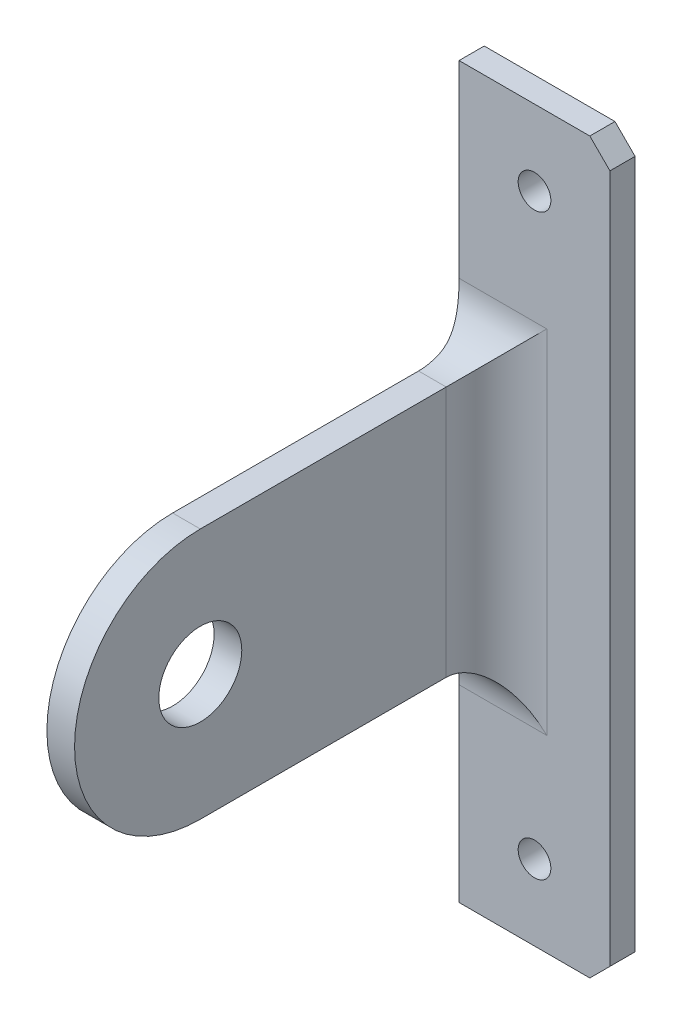
from build123d import *

# Parameters (mm, degrees)
SKETCH1_R               = 4.125
BOSS_EXTRUDE1_DEPTH     = 2.75
BOSS_EXTRUDE4_DEPTH     = 2.5
CUT_EXTRUDE2_REACH      = 80.314
SKETCH7_W               = 7
SKETCH7_H               = 16.5
SKETCH7_W_2             = 16
SKETCH7_H_2             = 8
CUT_EXTRUDE3_REACH      = 82.041
SKETCH9_W               = 2.75
SKETCH9_H               = 22.388822383
SKETCH8_W               = 2.75
SKETCH8_H               = 27.825
BOSS_EXTRUDE5_DEPTH     = 12.5
FILLET2_R               = 1
FILLET3_R               = 4
CUT_EXTRUDE4_DEPTH      = 74.103052287
CUT_EXTRUDE4_DEPTH_BACK = 74.103052287
SKETCH10_W              = 78.235731334
SKETCH10_H              = 6.290045588
SKETCH11_W              = 15
SKETCH11_H              = 2.5
BOSS_EXTRUDE6_DEPTH     = 12.5
BOSS_EXTRUDE7_DEPTH     = 2.5
SKETCH14_R              = 1.625
CUT_EXTRUDE5_DEPTH      = 2.5
FILLET4_R               = 5
CHAMFER1_SIZE           = 2


with BuildPart() as part:
    # Sketch1 → Boss-Extrude1 (new body)
    with BuildSketch(Plane(origin=(0, 0, 0), x_dir=(0, 0, -1), z_dir=(1, 0, 0))):
        with BuildLine():
            Line((0, 12.5), (34.45, 12.5))
            Line((34.45, 12.5), (34.45, -12.5))
            Line((34.45, -12.5), (0, -12.5))
            ThreePointArc((0, -12.5), (-12.5, 0), (0, 12.5))
        make_face()
        Circle(SKETCH1_R, mode=Mode.SUBTRACT)
    extrude(amount=BOSS_EXTRUDE1_DEPTH)

    # Sketch6 → Boss-Extrude4 (add)
    with BuildSketch(Plane(origin=(0, 0, -34.45), x_dir=(-1, 0, 0), z_dir=(0, 0, -1))):
        Polygon((-8.812505246, 36.25), (53.321583376, 36.25), (53.321583376, -36.25), (6.25, -36.25), (-19.178416624, -36.25), (-19.178416624, 36.25), align=None)
    extrude(amount=-BOSS_EXTRUDE4_DEPTH)

    # Sketch7 → Cut-Extrude2 (cut, up to next)
    with BuildSketch(Plane.XY.offset(-31.95), mode=Mode.PRIVATE) as cut_extrude2_sk1:
        with Locations((-1.711858899, -11.632438111)):
            Rectangle(SKETCH7_W, SKETCH7_H)
    cut_extrude2_tool1 = extrude(cut_extrude2_sk1.sketch, amount=-CUT_EXTRUDE2_REACH, mode=Mode.PRIVATE) & part.part
    # Sketch7 → Cut-Extrude2 (cut, up to next)
    with BuildSketch(Plane.XY.offset(-31.95), mode=Mode.PRIVATE) as cut_extrude2_sk2:
        with Locations((-16.5, 0)):
            Rectangle(SKETCH7_W_2, SKETCH7_H_2)
    cut_extrude2_tool2 = extrude(cut_extrude2_sk2.sketch, amount=-CUT_EXTRUDE2_REACH, mode=Mode.PRIVATE) & part.part
    add(cut_extrude2_tool1.solids().sort_by_distance((-1.711859, -11.632438, -31.95))[0], mode=Mode.SUBTRACT)
    add(cut_extrude2_tool2.solids().sort_by_distance((-16.5, 0, -31.95))[0], mode=Mode.SUBTRACT)

    # Sketch9 → Cut-Extrude3 (cut, up to next)
    with BuildSketch(Plane.XZ.offset(12.5), mode=Mode.PRIVATE) as cut_extrude3_sk1:
        with Locations((1.375, -20.755588809)):
            Rectangle(SKETCH9_W, SKETCH9_H)
    cut_extrude3_tool1 = extrude(cut_extrude3_sk1.sketch, amount=-CUT_EXTRUDE3_REACH, mode=Mode.PRIVATE) & part.part
    add(cut_extrude3_tool1.solids().sort_by_distance((1.375, -12.5, -20.755589))[0], mode=Mode.SUBTRACT)


with BuildPart() as cut_extrude3_piece_1:
    # of the separate pieces the step leaves, piece 1, a body of its own (cut_extrude3_pieces)
    add(part.part.solids().sort_by_distance((-53.321583376, 36.25, -31.95))[0])



with BuildPart() as cut_extrude3_piece_2:
    # of the separate pieces the step leaves, piece 2, a body of its own (cut_extrude3_pieces)
    add(part.part.solids().sort_by_distance((0, 12.5, 0))[0])


with BuildPart() as cut_extrude3_piece_1_1:
    add(cut_extrude3_piece_1.part)

    add(cut_extrude3_piece_2.part)  # Boss-Extrude5 merges Cut-Extrude3 piece 2
    # Sketch8 → Boss-Extrude5 (add, symmetric)
    with BuildSketch(Plane(origin=(0, 0, 0), x_dir=(1, 0, 0), z_dir=(0, 1, 0))):
        with Locations((1.375, 18.0375)):
            Rectangle(SKETCH8_W, SKETCH8_H)
    extrude(amount=BOSS_EXTRUDE5_DEPTH, both=True)

    # Fillet2
    fillet2_edges = [cut_extrude3_piece_1_1.edges().sort_by_distance(p)[0] for p in [
        (-8.5, 4, -33.2),
        (-8.5, -4, -33.2),
        (-24.5, -4, -33.2),
        (-24.5, 4, -33.2),
        (-5.211858899, -19.882438111, -33.2),
        (-5.211858899, -3.382438111, -33.2),
        (1.788141101, -3.382438111, -33.2),
        (1.788141101, -19.882438111, -33.2),
    ]]
    fillet(fillet2_edges, radius=FILLET2_R)

    # Fillet3
    fillet3_edges = [cut_extrude3_piece_1_1.edges().sort_by_distance(p)[0] for p in [
        (19.178416624, 36.25, -33.2),
        (-53.321583376, 36.25, -33.2),
        (-53.321583376, -36.25, -33.2),
        (19.178416624, -36.25, -33.2),
    ]]
    fillet(fillet3_edges, radius=FILLET3_R)

    # Sketch10 → Cut-Extrude4 (cut, two sides: drawn at the far end of the back side and taken through both)
    with BuildSketch(Plane(origin=(0, 0, 0), x_dir=(1, 0, 0), z_dir=(0, 1, 0)).offset(-CUT_EXTRUDE4_DEPTH_BACK)):
        with Locations((-17.391929865, 35.095022794)):
            Rectangle(SKETCH10_W, SKETCH10_H)
    extrude(amount=CUT_EXTRUDE4_DEPTH + CUT_EXTRUDE4_DEPTH_BACK, mode=Mode.SUBTRACT)

    # Sketch11 → Boss-Extrude6 (add, symmetric)
    with BuildSketch(Plane(origin=(0, 0, 0), x_dir=(1, 0, 0), z_dir=(0, 1, 0))):
        with Locations((6.53, 30.7)):
            Rectangle(SKETCH11_W, SKETCH11_H)
    boss_extrude6 = extrude(amount=BOSS_EXTRUDE6_DEPTH, both=True)

    # Sketch13 → Boss-Extrude7 (add)
    with BuildSketch(Plane(origin=(0, 0, -31.95), x_dir=(-1, 0, 0), z_dir=(0, 0, -1))):
        Polygon((-14.03, 12.5), (0.97, 12.5), (0.97, 36.25), (-10.03, 36.25), (-14.03, 36.25), (-14.03, 32.25), align=None)
    boss_extrude7 = extrude(amount=-BOSS_EXTRUDE7_DEPTH)

    # Mirror1: Boss-Extrude6, Boss-Extrude7 across plane
    add(boss_extrude6.mirror(Plane.ZX))
    add(boss_extrude7.mirror(Plane.ZX))

    # Sketch14 → Cut-Extrude5 (cut)
    with BuildSketch(Plane(origin=(0, 0, -31.95), x_dir=(-1, 0, 0), z_dir=(0, 0, -1))):
        with Locations((-6.53, 28.75)):
            Circle(SKETCH14_R)
    cut_extrude5 = extrude(amount=-CUT_EXTRUDE5_DEPTH, mode=Mode.SUBTRACT)

    # Mirror2: Cut-Extrude5 across plane
    add(cut_extrude5.mirror(Plane.ZX), mode=Mode.SUBTRACT)

    # Fillet4
    # the kernel refuses this fillet: 5 mm, written as the material it adds along each edge
    with BuildSketch(Plane(origin=(2.75, -12.5, -29.45), x_dir=(1, 0, 0), z_dir=(0, 1, 0))) as fillet4_piece_1:
        with BuildLine():
            CenterArc((FILLET4_R, -FILLET4_R), FILLET4_R, 90, 90)
            Line((0, -FILLET4_R), (-FILLET4_R * 0.02, -FILLET4_R))
            Line((-FILLET4_R * 0.02, -FILLET4_R), (-FILLET4_R * 0.02, FILLET4_R * 0.02))
            Line((-FILLET4_R * 0.02, FILLET4_R * 0.02), (FILLET4_R, FILLET4_R * 0.02))
            Line((FILLET4_R, FILLET4_R * 0.02), (FILLET4_R, 0))
        make_face()
    extrude(amount=25)
    with BuildSketch(Plane(origin=(0, -12.5, -29.45), x_dir=(-1, 0, 0), z_dir=(0, 1, 0))) as fillet4_piece_2:
        with BuildLine():
            CenterArc((5, 2.959577673), FILLET4_R, 180, 36.293058493)
            Line((0, 2.959577673), (-0.1, 2.959577673))
            Line((-0.1, 2.959577673), (-0.1, 0))
            Line((-0.1, 0), (0, -0.1))
            ThreePointArc((0, -0.1), (0.485, -0.1), (0.8894, -0.059191553))
            Line((0.8894, -0.059191553), (0.97, 0))
        make_face()
    extrude(amount=25)
    with BuildSketch(Plane(origin=(2.75, 12.5, -29.45), x_dir=(0, 0, 1), z_dir=(-1, 0, 0)), Plane(origin=(2.75, -12.5, -29.45), x_dir=(0, -1, 0), z_dir=(-1, 0, 0))) as fillet4_piece_3:
        with BuildLine():
            CenterArc((FILLET4_R, FILLET4_R), FILLET4_R, 180, 90)
            Line((0, FILLET4_R), (-FILLET4_R * 0.02, FILLET4_R))
            Line((-FILLET4_R * 0.02, FILLET4_R), (-FILLET4_R * 0.02, -FILLET4_R * 0.02))
            Line((-FILLET4_R * 0.02, -FILLET4_R * 0.02), (FILLET4_R, -FILLET4_R * 0.02))
            Line((FILLET4_R, -FILLET4_R * 0.02), (FILLET4_R, 0))
        make_face()
    extrude(amount=2.75)
    with BuildSketch(Plane(origin=(2.75, -25, -29.45), x_dir=(1, 0, 0), z_dir=(0, 1, 0))) as fillet4_piece_4a_section:
        with BuildLine():
            CenterArc((FILLET4_R, -FILLET4_R), FILLET4_R, 90, 90)
            Line((0, -FILLET4_R), (-FILLET4_R * 0.02, -FILLET4_R))
            Line((-FILLET4_R * 0.02, -FILLET4_R), (-FILLET4_R * 0.02, FILLET4_R * 0.02))
            Line((-FILLET4_R * 0.02, FILLET4_R * 0.02), (FILLET4_R, FILLET4_R * 0.02))
            Line((FILLET4_R, FILLET4_R * 0.02), (FILLET4_R, 0))
        make_face()
    fillet4_piece_4a = extrude(amount=37.5, mode=Mode.PRIVATE)
    fillet4_piece_4a = split(fillet4_piece_4a, bisect_by=Plane(origin=(3.881975571, -12.5, -28.318024429), z_dir=(0, -1, 0)), keep=Keep.TOP, mode=Mode.PRIVATE)
    with BuildSketch(Plane(origin=(15.25, -12.5, -29.45), x_dir=(0, -1, 0), z_dir=(-1, 0, 0))) as fillet4_piece_4b_section:
        with BuildLine():
            CenterArc((FILLET4_R, FILLET4_R), FILLET4_R, 180, 90)
            Line((0, FILLET4_R), (-FILLET4_R * 0.02, FILLET4_R))
            Line((-FILLET4_R * 0.02, FILLET4_R), (-FILLET4_R * 0.02, -FILLET4_R * 0.02))
            Line((-FILLET4_R * 0.02, -FILLET4_R * 0.02), (FILLET4_R, -FILLET4_R * 0.02))
            Line((FILLET4_R, -FILLET4_R * 0.02), (FILLET4_R, 0))
        make_face()
    fillet4_piece_4b = extrude(amount=15.25, mode=Mode.PRIVATE)
    fillet4_piece_4b = split(fillet4_piece_4b, bisect_by=Plane(origin=(14.03, -13.631975571, -28.318024429), z_dir=(-1, 0, 0)), keep=Keep.TOP, mode=Mode.PRIVATE)
    fillet4_piece_4b = split(fillet4_piece_4b, bisect_by=Plane(origin=(2.75, -13.631975571, -28.318024429), z_dir=(1, 0, 0)), keep=Keep.TOP, mode=Mode.PRIVATE)
    fillet4_piece_4 = fillet4_piece_4a & fillet4_piece_4b
    add(fillet4_piece_4)
    with BuildSketch(Plane(origin=(15.25, 12.5, -29.45), x_dir=(0, 0, 1), z_dir=(-1, 0, 0))) as fillet4_piece_5a_section:
        with BuildLine():
            CenterArc((FILLET4_R, FILLET4_R), FILLET4_R, 180, 90)
            Line((0, FILLET4_R), (-FILLET4_R * 0.02, FILLET4_R))
            Line((-FILLET4_R * 0.02, FILLET4_R), (-FILLET4_R * 0.02, -FILLET4_R * 0.02))
            Line((-FILLET4_R * 0.02, -FILLET4_R * 0.02), (FILLET4_R, -FILLET4_R * 0.02))
            Line((FILLET4_R, -FILLET4_R * 0.02), (FILLET4_R, 0))
        make_face()
    fillet4_piece_5a = extrude(amount=15.25, mode=Mode.PRIVATE)
    fillet4_piece_5a = split(fillet4_piece_5a, bisect_by=Plane(origin=(2.75, 13.631975571, -28.318024429), z_dir=(1, 0, 0)), keep=Keep.TOP, mode=Mode.PRIVATE)
    fillet4_piece_5a = split(fillet4_piece_5a, bisect_by=Plane(origin=(14.03, 13.631975571, -28.318024429), z_dir=(-1, 0, 0)), keep=Keep.TOP, mode=Mode.PRIVATE)
    with BuildSketch(Plane(origin=(2.75, -12.5, -29.45), x_dir=(1, 0, 0), z_dir=(0, 1, 0))) as fillet4_piece_5b_section:
        with BuildLine():
            CenterArc((FILLET4_R, -FILLET4_R), FILLET4_R, 90, 90)
            Line((0, -FILLET4_R), (-FILLET4_R * 0.02, -FILLET4_R))
            Line((-FILLET4_R * 0.02, -FILLET4_R), (-FILLET4_R * 0.02, FILLET4_R * 0.02))
            Line((-FILLET4_R * 0.02, FILLET4_R * 0.02), (FILLET4_R, FILLET4_R * 0.02))
            Line((FILLET4_R, FILLET4_R * 0.02), (FILLET4_R, 0))
        make_face()
    fillet4_piece_5b = extrude(amount=37.5, mode=Mode.PRIVATE)
    fillet4_piece_5b = split(fillet4_piece_5b, bisect_by=Plane(origin=(3.881975571, 12.5, -28.318024429), z_dir=(0, 1, 0)), keep=Keep.TOP, mode=Mode.PRIVATE)
    fillet4_piece_5 = fillet4_piece_5a & fillet4_piece_5b
    add(fillet4_piece_5)
    with BuildSketch(Plane(origin=(2.75, -12.5, -29.45), x_dir=(0, -1, 0), z_dir=(-1, 0, 0))) as fillet4_piece_6a_section:
        with BuildLine():
            CenterArc((FILLET4_R, FILLET4_R), FILLET4_R, 180, 90)
            Line((0, FILLET4_R), (-FILLET4_R * 0.02, FILLET4_R))
            Line((-FILLET4_R * 0.02, FILLET4_R), (-FILLET4_R * 0.02, -FILLET4_R * 0.02))
            Line((-FILLET4_R * 0.02, -FILLET4_R * 0.02), (FILLET4_R, -FILLET4_R * 0.02))
            Line((FILLET4_R, -FILLET4_R * 0.02), (FILLET4_R, 0))
        make_face()
    fillet4_piece_6a = extrude(amount=15.25, mode=Mode.PRIVATE)
    fillet4_piece_6a = split(fillet4_piece_6a, bisect_by=Plane(origin=(-0.97, -13.631975571, -28.318024429), z_dir=(1, 0, 0)), keep=Keep.TOP, mode=Mode.PRIVATE)
    fillet4_piece_6a = split(fillet4_piece_6a, bisect_by=Plane(origin=(0, -13.631975571, -28.318024429), z_dir=(-1, 0, 0)), keep=Keep.TOP, mode=Mode.PRIVATE)
    with BuildSketch(Plane(origin=(0, -19.898944181, -29.45), x_dir=(-1, 0, 0), z_dir=(0, 1, 0))) as fillet4_piece_6b_section:
        with BuildLine():
            CenterArc((5, 2.959577673), FILLET4_R, 180, 36.293058493)
            Line((0, 2.959577673), (-0.1, 2.959577673))
            Line((-0.1, 2.959577673), (-0.1, 0))
            Line((-0.1, 0), (0, -0.1))
            ThreePointArc((0, -0.1), (0.485, -0.1), (0.8894, -0.059191553))
            Line((0.8894, -0.059191553), (0.97, 0))
        make_face()
    fillet4_piece_6b = extrude(amount=32.398944181, mode=Mode.PRIVATE)
    fillet4_piece_6b = split(fillet4_piece_6b, bisect_by=Plane(origin=(-0.217435867, -12.5, -28.607978011), z_dir=(0, -1, 0)), keep=Keep.TOP, mode=Mode.PRIVATE)
    fillet4_piece_6 = fillet4_piece_6a & fillet4_piece_6b
    add(fillet4_piece_6)
    with BuildSketch(Plane(origin=(2.75, 12.5, -29.45), x_dir=(0, 0, 1), z_dir=(-1, 0, 0))) as fillet4_piece_7a_section:
        with BuildLine():
            CenterArc((FILLET4_R, FILLET4_R), FILLET4_R, 180, 90)
            Line((0, FILLET4_R), (-FILLET4_R * 0.02, FILLET4_R))
            Line((-FILLET4_R * 0.02, FILLET4_R), (-FILLET4_R * 0.02, -FILLET4_R * 0.02))
            Line((-FILLET4_R * 0.02, -FILLET4_R * 0.02), (FILLET4_R, -FILLET4_R * 0.02))
            Line((FILLET4_R, -FILLET4_R * 0.02), (FILLET4_R, 0))
        make_face()
    fillet4_piece_7a = extrude(amount=15.25, mode=Mode.PRIVATE)
    fillet4_piece_7a = split(fillet4_piece_7a, bisect_by=Plane(origin=(0, 13.631975571, -28.318024429), z_dir=(-1, 0, 0)), keep=Keep.TOP, mode=Mode.PRIVATE)
    fillet4_piece_7a = split(fillet4_piece_7a, bisect_by=Plane(origin=(-0.97, 13.631975571, -28.318024429), z_dir=(1, 0, 0)), keep=Keep.TOP, mode=Mode.PRIVATE)
    with BuildSketch(Plane(origin=(0, -12.5, -29.45), x_dir=(-1, 0, 0), z_dir=(0, 1, 0))) as fillet4_piece_7b_section:
        with BuildLine():
            CenterArc((5, 2.959577673), FILLET4_R, 180, 36.293058493)
            Line((0, 2.959577673), (-0.1, 2.959577673))
            Line((-0.1, 2.959577673), (-0.1, 0))
            Line((-0.1, 0), (0, -0.1))
            ThreePointArc((0, -0.1), (0.485, -0.1), (0.8894, -0.059191553))
            Line((0.8894, -0.059191553), (0.97, 0))
        make_face()
    fillet4_piece_7b = extrude(amount=32.398944181, mode=Mode.PRIVATE)
    fillet4_piece_7b = split(fillet4_piece_7b, bisect_by=Plane(origin=(-0.217435867, 12.5, -28.607978011), z_dir=(0, 1, 0)), keep=Keep.TOP, mode=Mode.PRIVATE)
    fillet4_piece_7 = fillet4_piece_7a & fillet4_piece_7b
    add(fillet4_piece_7)

    # Chamfer1
    chamfer1_edges = [cut_extrude3_piece_1_1.edges().sort_by_distance(p)[0] for p in [
        (14.03, 36.25, -30.7),
        (14.03, -36.25, -30.7),
    ]]
    chamfer(chamfer1_edges, length=CHAMFER1_SIZE)


solid = cut_extrude3_piece_1_1.part
